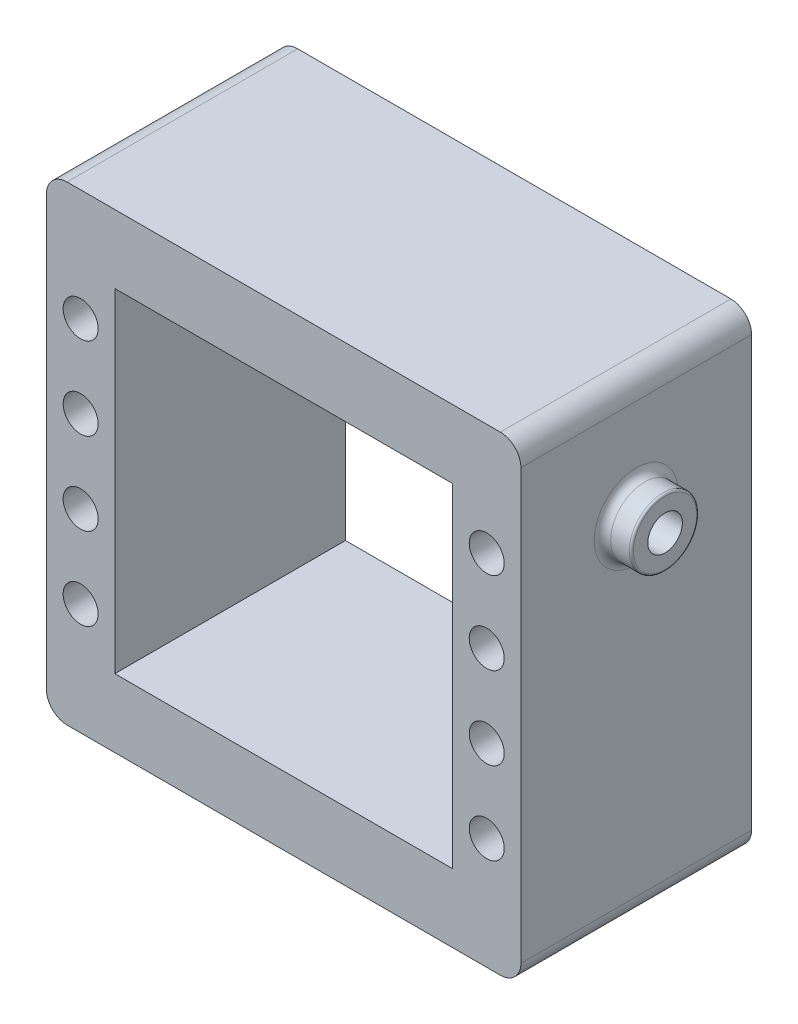
from build123d import *

# Parameters (mm, degrees)
SKETCH1_W           = 57.6
SKETCH1_H           = 57.1
SKETCH1_R           = 2.125
SKETCH1_W_2         = 41
SKETCH1_H_2         = 40.5
BOSS_EXTRUDE1_DEPTH = 28
FILLET1_R           = 2.5
SKETCH2_R           = 4.1
SKETCH2_R_2         = 2.1
BOSS_EXTRUDE2_DEPTH = 3.5
FILLET2_R           = 1
FILLET3_R           = 0.25


with BuildPart() as part:
    # Sketch1 → Boss-Extrude1 (new body)
    with BuildSketch(Plane.XY):
        with Locations((20.5, 20.25)):
            Rectangle(SKETCH1_W, SKETCH1_H)
        with Locations((-4.15, 25.25)):
            Circle(SKETCH1_R, mode=Mode.SUBTRACT)
        with Locations((-4.15, 35.25)):
            Circle(SKETCH1_R, mode=Mode.SUBTRACT)
        with Locations((-4.15, 5.25)):
            Circle(SKETCH1_R, mode=Mode.SUBTRACT)
        with Locations((-4.15, 15.25)):
            Circle(SKETCH1_R, mode=Mode.SUBTRACT)
        with Locations((45.15, 15.25)):
            Circle(SKETCH1_R, mode=Mode.SUBTRACT)
        with Locations((45.15, 5.25)):
            Circle(SKETCH1_R, mode=Mode.SUBTRACT)
        with Locations((45.15, 35.25)):
            Circle(SKETCH1_R, mode=Mode.SUBTRACT)
        with Locations((45.15, 25.25)):
            Circle(SKETCH1_R, mode=Mode.SUBTRACT)
        with Locations((20.5, 20.25)):
            Rectangle(SKETCH1_W_2, SKETCH1_H_2, mode=Mode.SUBTRACT)
    extrude(amount=BOSS_EXTRUDE1_DEPTH)

    # Fillet1
    fillet1_edges = [part.edges().sort_by_distance(p)[0] for p in [
        (49.3, 48.8, 14),
        (49.3, -8.3, 14),
        (-8.3, -8.3, 14),
        (-8.3, 48.8, 14),
    ]]
    fillet(fillet1_edges, radius=FILLET1_R)

    # Sketch2 → Boss-Extrude2 (add)
    with BuildSketch(Plane.ZY.offset(-49.3)):
        with Locations((14, 34.2)):
            Circle(SKETCH2_R)
        with Locations((14, 34.2)):
            Circle(SKETCH2_R_2, mode=Mode.SUBTRACT)
    extrude(amount=-BOSS_EXTRUDE2_DEPTH)

    # Fillet2
    fillet2_edges = [part.edges().sort_by_distance(p)[0] for p in [
        (49.3, 34.2, 9.9),
    ]]
    fillet(fillet2_edges, radius=FILLET2_R)

    # Fillet3
    fillet3_edges = [part.edges().sort_by_distance(p)[0] for p in [
        (52.8, 34.2, 9.9),
    ]]
    fillet(fillet3_edges, radius=FILLET3_R)


solid = part.part
